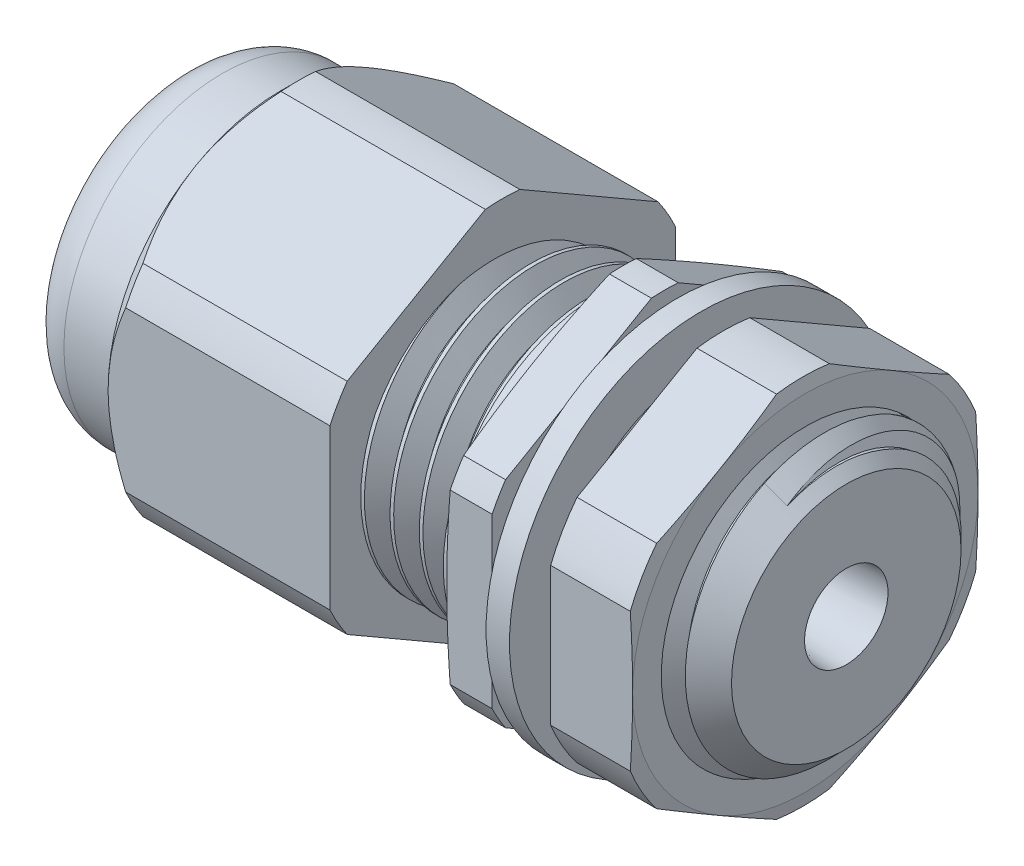
from build123d import *
from build123d.topology import SkipClean

# Parameters (mm, degrees)
CHAMFER2_SIZE            = 1.27
SKETCH12_OUTSIDE_W       = 77.286
SKETCH12_OUTSIDE_H       = 77.286
CUT_EXTRUDE2_DEPTH       = 9.369777778
SKETCH34_OUTSIDE_W       = 77.286
SKETCH34_OUTSIDE_H       = 77.286
CUT_EXTRUDE8_DEPTH       = 46.190991959
SKETCH27_R               = 6.25
BOSS_EXTRUDE3_DEPTH      = 3.556
FILLET4_R                = 1.8796
SKETCH19_OUTSIDE_W       = 28.31
SKETCH19_OUTSIDE_H       = 29.998
SKETCH19_OUTSIDE_R       = 7.493
CUT_EXTRUDE3_DEPTH       = 1.999996
CUT_EXTRUDE3_DRAFT       = -45
CUT_SWEEP1_PITCH         = 1.27
BOSS_EXTRUDE1_DEPTH      = 0.254
BOSS_EXTRUDE1_DEPTH_BACK = 8.609128
SKETCH24_R               = 4.98
SKETCH29_OUTSIDE_W       = 81.93
SKETCH29_OUTSIDE_H       = 83.618
SKETCH29_OUTSIDE_R       = 7.493
CUT_EXTRUDE5_DEPTH       = 5.08
CUT_EXTRUDE5_DRAFT       = -80
SKETCH30_OUTSIDE_W       = 81.93
SKETCH30_OUTSIDE_H       = 83.618
SKETCH30_OUTSIDE_R       = 7.493
CUT_EXTRUDE7_DEPTH       = 5.08
CUT_EXTRUDE7_DRAFT       = 80
SKETCH32_W               = 1.016
SKETCH32_H               = 2.041018494
BOSS_EXTRUDE4_START      = -2.7559
SKETCH35_R               = 6.858
SKETCH35_R_2             = 1.016
BOSS_EXTRUDE4_DEPTH      = 2.7559
FILLET5_R                = 0.19685


with BuildPart() as part:
    # Sketch10 → Revolve2 (revolve)
    with BuildSketch(Plane.XY, mode=Mode.PRIVATE) as revolve2_sk:
        Polygon((-15.166622222, 1.016), (-24.5364, 1.016), (-24.5364, 1.4224), (-28.956, 1.4224), (-28.956, 6.8715), (-24.5364, 6.8715), (-24.5364, 28.956), (-15.166622222, 28.956), (-15.166622222, 6.25), (-9.8425, 6.25), (-9.8425, 28.956), (-7.874, 28.956), (-7.874, 6.25), (0, 6.25), (0, 1.81084899), align=None)
    revolve(revolve2_sk.sketch.rotate(Axis((114.346923356, 0, 0), (-1, 0, 0)), 90), axis=Axis((114.346923356, 0, 0), (-1, 0, 0)))

    # Chamfer2
    chamfer2_edges = [part.edges().sort_by_distance(p)[0] for p in [
        (0, 0, 6.25),
    ]]
    chamfer(chamfer2_edges, length=CHAMFER2_SIZE)

    # Sketch12 outside → Cut-Extrude2 (cut)
    with BuildSketch(Plane.ZY.offset(24.5364)):
        Rectangle(SKETCH12_OUTSIDE_W, SKETCH12_OUTSIDE_H)
        with BuildLine():
            Line((-0.7493, 8.219562577), (-6.7437, 4.758694124))
            ThreePointArc((-6.7437, 4.758694124), (-7.147866436, 4.126822611), (-7.493, 3.460868454))
            Line((-7.493, 3.460868454), (-7.493, -3.460868454))
            ThreePointArc((-7.493, -3.460868454), (-7.147866436, -4.126822611), (-6.7437, -4.758694124))
            Line((-6.7437, -4.758694124), (-0.7493, -8.219562577))
            ThreePointArc((-0.7493, -8.219562577), (0, -8.253645222), (0.7493, -8.219562577))
            Line((0.7493, -8.219562577), (6.7437, -4.758694124))
            ThreePointArc((6.7437, -4.758694124), (7.147866436, -4.126822611), (7.493, -3.460868454))
            Line((7.493, -3.460868454), (7.493, 3.460868454))
            ThreePointArc((7.493, 3.460868454), (7.147866436, 4.126822611), (6.7437, 4.758694124))
            Line((6.7437, 4.758694124), (0.7493, 8.219562577))
            ThreePointArc((0.7493, 8.219562577), (0, 8.253645222), (-0.7493, 8.219562577))
        make_face(mode=Mode.SUBTRACT)
    extrude(amount=-CUT_EXTRUDE2_DEPTH, mode=Mode.SUBTRACT)

    # Sketch34 outside → Cut-Extrude8 (cut, through all)
    with BuildSketch(Plane.ZY.offset(9.8425)):
        Rectangle(SKETCH34_OUTSIDE_W, SKETCH34_OUTSIDE_H)
        with BuildLine():
            Line((-0.581540632, 8.316418494), (-6.911459368, 4.661838207))
            ThreePointArc((-6.911459368, 4.661838207), (-7.219816795, 4.16836317), (-7.493, 3.654580286))
            Line((-7.493, 3.654580286), (-7.493, -3.654580286))
            ThreePointArc((-7.493, -3.654580286), (-7.219816795, -4.16836317), (-6.911459368, -4.661838207))
            Line((-6.911459368, -4.661838207), (-0.581540632, -8.316418494))
            ThreePointArc((-0.581540632, -8.316418494), (0, -8.33672634), (0.581540632, -8.316418494))
            Line((0.581540632, -8.316418494), (6.911459368, -4.661838207))
            ThreePointArc((6.911459368, -4.661838207), (7.219816795, -4.16836317), (7.493, -3.654580286))
            Line((7.493, -3.654580286), (7.493, 3.654580286))
            ThreePointArc((7.493, 3.654580286), (7.219816795, 4.16836317), (6.911459368, 4.661838207))
            Line((6.911459368, 4.661838207), (0.581540632, 8.316418494))
            ThreePointArc((0.581540632, 8.316418494), (0, 8.33672634), (-0.581540632, 8.316418494))
        make_face(mode=Mode.SUBTRACT)
    extrude(amount=-CUT_EXTRUDE8_DEPTH, mode=Mode.SUBTRACT)

    # Fillet4
    fillet4_edges = [part.edges().sort_by_distance(p)[0] for p in [
        (-28.956, 0, 6.8715),
    ]]
    fillet(fillet4_edges, radius=FILLET4_R)


with BuildPart() as body_2:
    # Sketch27 → Boss-Extrude3 (new body)
    with BuildSketch(Plane(origin=(-5.334, 0, 0), x_dir=(0, 0, -1), z_dir=(1, 0, 0))):
        with BuildLine():
            Line((-1.145309589, 7.990926334), (-6.347690411, 4.987330367))
            ThreePointArc((-6.347690411, 4.987330367), (-6.991064175, 4.036292784), (-7.493, 3.003595968))
            Line((-7.493, 3.003595968), (-7.493, -3.003595968))
            ThreePointArc((-7.493, -3.003595968), (-6.991064175, -4.036292784), (-6.347690411, -4.987330367))
            Line((-6.347690411, -4.987330367), (-1.145309589, -7.990926334))
            ThreePointArc((-1.145309589, -7.990926334), (0, -8.072585567), (1.145309589, -7.990926334))
            Line((1.145309589, -7.990926334), (6.347690411, -4.987330367))
            ThreePointArc((6.347690411, -4.987330367), (6.991064175, -4.036292784), (7.493, -3.003595968))
            Line((7.493, -3.003595968), (7.493, 3.003595968))
            ThreePointArc((7.493, 3.003595968), (6.991064175, 4.036292784), (6.347690411, 4.987330367))
            Line((6.347690411, 4.987330367), (1.145309589, 7.990926334))
            ThreePointArc((1.145309589, 7.990926334), (0, 8.072585567), (-1.145309589, 7.990926334))
        make_face()
        Circle(SKETCH27_R, mode=Mode.SUBTRACT)
    extrude(amount=BOSS_EXTRUDE3_DEPTH)


with BuildPart() as cut_extrude3_tool:
    # Sketch19 outside → Cut-Extrude3 (with draft: the straight prism first)
    with BuildSketch(Plane.ZY.offset(24.5364)):
        Rectangle(SKETCH19_OUTSIDE_W, SKETCH19_OUTSIDE_H)
        Circle(SKETCH19_OUTSIDE_R, mode=Mode.SUBTRACT)
    extrude(amount=-CUT_EXTRUDE3_DEPTH)
    # Cut-Extrude3: the draft: its side faces are tilted about the plane it starts from
    cut_extrude3_sides = [cut_extrude3_tool.faces().sort_by_distance(p)[0] for p in [
        (-23.536402, -14.999, 0),
        (-23.536402, 0, 14.155),
        (-23.536402, 14.999, 0),
        (-23.536402, 0, -14.155),
        (-23.536402, 0, -7.493),
    ]]
    draft(cut_extrude3_sides, Plane.ZY.offset(24.5364), CUT_EXTRUDE3_DRAFT)


with BuildPart() as part_1:
    add(part.part)

    # Cut-Extrude3: cut by cut_extrude3_tool
    add(cut_extrude3_tool.part, mode=Mode.SUBTRACT)

    # Cut-Sweep1: arcs per turn and ends read off the stored shape
    # Cut-Sweep1: the profile of Sketch26 screwed along a right-hand helix through 20 turns, 8 arcs to a turn; built about Z, then put on its axis
    cut_sweep1_z = Axis((0, 0, 0), (0, 0, 1))
    cut_sweep1_corners = [(6.386634343, 8.0257e-05, -1.190625013), (6.317893576, 7.9393e-05, 0.039687487), (6.24915281, 7.8529e-05, -1.3e-08), (5.424263613, 6.8163e-05, -0.476250013), (5.424263613, 6.8163e-05, -0.635000013), (6.24915281, 7.8529e-05, -1.111250013), (6.317893576, 7.9393e-05, -1.150937513)]
    with BuildLine(mode=Mode.PRIVATE) as cut_sweep1_profile:
        Line(cut_sweep1_corners[0], cut_sweep1_corners[1])
        Line(cut_sweep1_corners[1], cut_sweep1_corners[2])
        Line(cut_sweep1_corners[2], cut_sweep1_corners[3])
        Line(cut_sweep1_corners[3], cut_sweep1_corners[4])
        Line(cut_sweep1_corners[4], cut_sweep1_corners[5])
        Line(cut_sweep1_corners[5], cut_sweep1_corners[6])
        Line(cut_sweep1_corners[6], cut_sweep1_corners[0])
    cut_sweep1_cap = Face(cut_sweep1_profile.wire())
    cut_sweep1_turn_angles = [0, 22.5, 45, 67.5, 90, 112.5, 135, 157.5, 180, 202.5, 225, 247.5, 270, 292.5, 315, 337.5, 360]
    cut_sweep1_turn_weights = [1, 0.9238795325112867, 1, 0.9238795325112867, 1, 0.9238795325112867, 1, 0.9238795325112867, 1, 0.9238795325112867, 1, 0.9238795325112867, 1, 0.9238795325112867, 1, 0.9238795325112867, 1]
    cut_sweep1_turn_rails = [Edge.make_bspline([Vector(p[0], p[1], 0).rotate(cut_sweep1_z, cut_sweep1_turn_angles[k]) / cut_sweep1_turn_weights[k] + Vector(0, 0, p[2] + CUT_SWEEP1_PITCH * cut_sweep1_turn_angles[k] / 360) for k in range(17)], [0, 0, 0, 1, 1, 2, 2, 3, 3, 4, 4, 5, 5, 6, 6, 7, 7, 8, 8, 8], 2, cut_sweep1_turn_weights) for p in cut_sweep1_corners]
    cut_sweep1_turn_sides = [Face.make_surface_from_curves(cut_sweep1_turn_rails[p[0]], cut_sweep1_turn_rails[p[1]]) for p in [(0, 1), (1, 2), (2, 3), (3, 4), (4, 5), (5, 6), (6, 0)]]
    cut_sweep1 = Plane(origin=(-15.166622222, 0, 0), x_dir=(0, 0.9848077530122086, -0.1736481776669274), z_dir=(1, 0, 0)) * Solid(Shell([*[p.moved(Location((0, 0, CUT_SWEEP1_PITCH * i))) for i in range(20) for p in cut_sweep1_turn_sides], cut_sweep1_cap, cut_sweep1_cap.rotate(cut_sweep1_z, 7200).moved(Location((0, 0, CUT_SWEEP1_PITCH * 7200 / 360)))]))
    add(cut_sweep1, mode=Mode.SUBTRACT)

    # Sketch24 → Boss-Extrude1 (add, two sides: drawn at the far end of the back side and taken through both)
    with SkipClean():  # the faces are left unmerged after this step: merging them gives an invalid solid
        with BuildSketch(Plane(origin=(-15.166622222, 0, 0), x_dir=(0, 0, -1), z_dir=(1, 0, 0)).offset(-BOSS_EXTRUDE1_DEPTH_BACK)):
            with BuildLine():
                Line((6.7437, 4.758694124), (0.7493, 8.219562577))
                ThreePointArc((0.7493, 8.219562577), (0, 8.253645222), (-0.7493, 8.219562577))
                Line((-0.7493, 8.219562577), (-6.7437, 4.758694124))
                ThreePointArc((-6.7437, 4.758694124), (-7.147866436, 4.126822611), (-7.493, 3.460868454))
                Line((-7.493, 3.460868454), (-7.493, -3.460868454))
                ThreePointArc((-7.493, -3.460868454), (-7.147866436, -4.126822611), (-6.7437, -4.758694124))
                Line((-6.7437, -4.758694124), (-0.7493, -8.219562577))
                ThreePointArc((-0.7493, -8.219562577), (0, -8.253645222), (0.7493, -8.219562577))
                Line((0.7493, -8.219562577), (6.7437, -4.758694124))
                ThreePointArc((6.7437, -4.758694124), (7.147866436, -4.126822611), (7.493, -3.460868454))
                Line((7.493, -3.460868454), (7.493, 3.460868454))
                ThreePointArc((7.493, 3.460868454), (7.147866436, 4.126822611), (6.7437, 4.758694124))
            make_face()
            Circle(SKETCH24_R, mode=Mode.SUBTRACT)
        extrude(amount=BOSS_EXTRUDE1_DEPTH + BOSS_EXTRUDE1_DEPTH_BACK)
    add(part_1.part.scale(1), mode=Mode.REPLACE)  # the faces are merged on a copy


with BuildPart() as body_3:
    # Sketch20 → Revolve3 (revolve)
    with BuildSketch(Plane.XY, mode=Mode.PRIVATE) as revolve3_sk:
        with BuildLine():
            Line((-25.0444, 1.4224), (-25.0444, 1.016))
            Line((-25.0444, 1.016), (-28.194, 1.016))
            Line((-28.194, 1.016), (-28.194, 1.1684))
            ThreePointArc((-28.194, 1.1684), (-28.119605122, 1.348005122), (-27.94, 1.4224))
            Line((-27.94, 1.4224), (-25.0444, 1.4224))
        make_face()
    revolve(revolve3_sk.sketch.rotate(Axis((0, 0, 0), (-1, 0, 0)), 90), axis=Axis((0, 0, 0), (-1, 0, 0)))


with BuildPart() as cut_extrude5_tool:
    # Sketch29 outside → Cut-Extrude5 (with draft: the straight prism first)
    with BuildSketch(Plane(origin=(-1.778, 0, 0), x_dir=(0, 0, -1), z_dir=(1, 0, 0))):
        Rectangle(SKETCH29_OUTSIDE_W, SKETCH29_OUTSIDE_H)
        Circle(SKETCH29_OUTSIDE_R, mode=Mode.SUBTRACT)
    extrude(amount=-CUT_EXTRUDE5_DEPTH)
    # Cut-Extrude5: the draft: its side faces are tilted about the plane it starts from
    cut_extrude5_sides = [cut_extrude5_tool.faces().sort_by_distance(p)[0] for p in [
        (-4.318, -41.809, 0),
        (-4.318, 0, -40.965),
        (-4.318, 41.809, 0),
        (-4.318, 0, 40.965),
        (-4.318, 0, 7.493),
    ]]
    draft(cut_extrude5_sides, Plane(origin=(-1.778, 0, 0), x_dir=(0, 0, -1), z_dir=(1, 0, 0)), CUT_EXTRUDE5_DRAFT)


with BuildPart() as body_2_1:
    add(body_2.part)

    # Cut-Extrude5: cut by cut_extrude5_tool
    add(cut_extrude5_tool.part, mode=Mode.SUBTRACT)


with BuildPart() as cut_extrude7_tool:
    # Sketch30 outside → Cut-Extrude7 (with draft: the straight prism first)
    with BuildSketch(Plane(origin=(-9.8425, 0, 0), x_dir=(0, 0, -1), z_dir=(1, 0, 0))):
        Rectangle(SKETCH30_OUTSIDE_W, SKETCH30_OUTSIDE_H)
        Circle(SKETCH30_OUTSIDE_R, mode=Mode.SUBTRACT)
    extrude(amount=CUT_EXTRUDE7_DEPTH)
    # Cut-Extrude7: the draft: its side faces are tilted about the plane it starts from
    cut_extrude7_sides = [cut_extrude7_tool.faces().sort_by_distance(p)[0] for p in [
        (-7.3025, -41.809, 0),
        (-7.3025, 0, -40.965),
        (-7.3025, 41.809, 0),
        (-7.3025, 0, 40.965),
        (-7.3025, 0, 7.493),
    ]]
    draft(cut_extrude7_sides, Plane(origin=(-9.8425, 0, 0), x_dir=(0, 0, -1), z_dir=(1, 0, 0)), CUT_EXTRUDE7_DRAFT)


with BuildPart() as part_2:
    add(part_1.part)

    # Cut-Extrude7: cut by cut_extrude7_tool
    add(cut_extrude7_tool.part, mode=Mode.SUBTRACT)

    # Sketch35 → Boss-Extrude4 (add)
    with BuildSketch(Plane(origin=(-7.874, 0, 0), x_dir=(0, 0, -1), z_dir=(1, 0, 0)).offset(BOSS_EXTRUDE4_START)):
        Circle(SKETCH35_R)
        Circle(SKETCH35_R_2, mode=Mode.SUBTRACT)
    extrude(amount=BOSS_EXTRUDE4_DEPTH)

    # Fillet5
    fillet5_edges = [part_2.edges().sort_by_distance(p)[0] for p in [
        (-9.8425, 0, 6.858),
    ]]
    fillet(fillet5_edges, radius=FILLET5_R)


with BuildPart() as body_4:
    # Sketch32 → Revolve4 (revolve)
    with BuildSketch(Plane.XY, mode=Mode.PRIVATE) as revolve4_sk:
        with Locations((-6.80643155, 7.295909247)):
            Rectangle(SKETCH32_W, SKETCH32_H)
    revolve(revolve4_sk.sketch.rotate(Axis((114.346923356, 0, 0), (-1, 0, 0)), 336.947330245), axis=Axis((114.346923356, 0, 0), (-1, 0, 0)))


solid = Compound([body_3.part, body_2_1.part, part_2.part, body_4.part])
